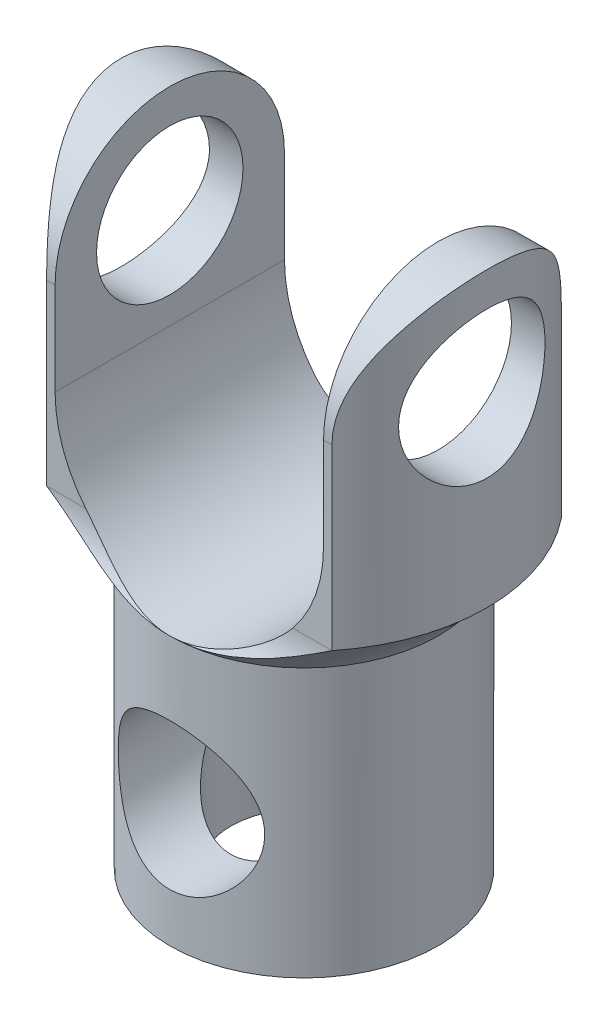
from build123d import *

# Parameters (mm, degrees)
SKETCH1_R               = 2.75
SKETCH1_R_2             = 1.5
BOSS_EXTRUDE1_DEPTH     = 4.5
SKETCH2_R               = 2.75
BOSS_EXTRUDE2_DEPTH     = 1
SKETCH4_R               = 3.75
BOSS_EXTRUDE3_DEPTH     = 6
CUT_EXTRUDE2_DEPTH      = 14.578475761
CUT_EXTRUDE2_DEPTH_BACK = 14.578475761
CUT_EXTRUDE3_DEPTH      = 14.336978811
CUT_EXTRUDE3_DEPTH_BACK = 14.336978811
CUT_EXTRUDE4_DEPTH      = 14.336978811
CUT_EXTRUDE4_DEPTH_BACK = 14.336978811
SKETCH7_R               = 1.5
SKETCH9_R               = 1.5
CUT_EXTRUDE5_DEPTH      = 14.336978811


with BuildPart() as part:
    # Sketch1 → Boss-Extrude1 (new body)
    with BuildSketch(Plane(origin=(0, 0, 0), x_dir=(1, 0, 0), z_dir=(0, 1, 0))):
        with Locations(Location((0, 0, 0), (0, 0, 270))):
            Circle(SKETCH1_R)
        with Locations(Location((0, 0, 0), (0, 0, 270))):
            Circle(SKETCH1_R_2, mode=Mode.SUBTRACT)
    extrude(amount=BOSS_EXTRUDE1_DEPTH)

    # Sketch2 → Boss-Extrude2 (add)
    with BuildSketch(Plane(origin=(0, 4.5, 0), x_dir=(1, 0, 0), z_dir=(0, 1, 0))):
        with Locations(Location((0, 0, 0), (0, 0, 270))):
            Circle(SKETCH2_R)
    extrude(amount=BOSS_EXTRUDE2_DEPTH)

    # Loft1: read off the stored shape, not the designer's step
    # Loft1: loft between two sections, ruled curve by curve
    loft1_from = [
        Edge.make_bspline([(-2.7249459, 5.5, -0.370364471), (-3.465674842, 5.5, 5.079527329), (1.984216958, 5.5, 5.820256271), (2.7249459, 5.5, 0.370364471), (3.465674842, 5.5, -5.079527329), (-1.984216958, 5.5, -5.820256271), (-2.7249459, 5.5, -0.370364471)], [0, 0, 0, 0, 0.5, 0.5, 0.5, 1, 1, 1, 1], 3, [1, 0.333333333, 0.333333333, 1, 0.333333333, 0.333333333, 1]),
    ]
    loft1_to = [
        Edge.make_bspline([(-3.66375351, 6.5, 0.799631301), (-2.064490908, 6.5, 8.127138321), (5.263016112, 6.5, 6.527875719), (3.66375351, 6.5, -0.799631301), (2.064490908, 6.5, -8.127138321), (-5.263016112, 6.5, -6.527875719), (-3.66375351, 6.5, 0.799631301)], [0, 0, 0, 0, 0.5, 0.5, 0.5, 1, 1, 1, 1], 3, [1, 0.333333333, 0.333333333, 1, 0.333333333, 0.333333333, 1]),
    ]
    loft1 = Solid(Shell([*[Face.make_surface_from_curves(loft1_from[k], loft1_to[k]) for k in range(1)], Face(Wire(loft1_from)), Face(Wire(loft1_to))]))
    add(loft1)

    # Sketch4 → Boss-Extrude3 (add)
    with BuildSketch(Plane(origin=(0, 6.5, 0), x_dir=(1, 0, 0), z_dir=(0, 1, 0))):
        with Locations(Location((0, 0, 0), (0, 0, 192.312))):
            Circle(SKETCH4_R)
    extrude(amount=BOSS_EXTRUDE3_DEPTH)

    # Sketch5 → Cut-Extrude2 (cut, two sides: drawn at the far end of the back side and taken through both)
    with BuildSketch(Plane(origin=(0, 0, 0), x_dir=(0, 0, -1), z_dir=(1, 0, 0)).offset(-CUT_EXTRUDE2_DEPTH_BACK)):
        with BuildLine():
            Line((2.35, 10.15), (2.35, 6.5))
            ThreePointArc((2.35, 6.5), (2.453708798, 5.961483519), (2.75, 5.5))
            Line((2.75, 5.5), (3.75, 6.5))
            Line((3.75, 6.5), (3.75, 12.5))
            Line((3.75, 12.5), (0, 12.5))
            ThreePointArc((0, 12.5), (1.661700936, 11.811700936), (2.35, 10.15))
        make_face()
        with BuildLine():
            ThreePointArc((-2.35, 10.15), (-1.661700936, 11.811700936), (0, 12.5))
            Line((0, 12.5), (-3.75, 12.5))
            Line((-3.75, 12.5), (-3.75, 6.5))
            Line((-3.75, 6.5), (-2.75, 5.5))
            ThreePointArc((-2.75, 5.5), (-2.453708798, 5.961483519), (-2.35, 6.5))
            Line((-2.35, 6.5), (-2.35, 10.15))
        make_face()
    extrude(amount=CUT_EXTRUDE2_DEPTH + CUT_EXTRUDE2_DEPTH_BACK, mode=Mode.SUBTRACT)

    # Sketch6 → Cut-Extrude3 (cut, two sides: drawn at the far end of the back side and taken through both)
    with BuildSketch(Plane.XY.offset(-CUT_EXTRUDE3_DEPTH_BACK)):
        with BuildLine():
            Line((2.75, 8.25), (2.75, 12.5))
            Line((2.75, 12.5), (-2.75, 12.5))
            Line((-2.75, 12.5), (-2.75, 8.25))
            ThreePointArc((-2.75, 8.25), (0, 5.5), (2.75, 8.25))
        make_face()
    extrude(amount=CUT_EXTRUDE3_DEPTH + CUT_EXTRUDE3_DEPTH_BACK, mode=Mode.SUBTRACT)

    # Sketch7 → Cut-Extrude4 (cut, two sides: drawn at the far end of the back side and taken through both)
    with BuildSketch(Plane(origin=(0, 0, 0), x_dir=(0, 0, -1), z_dir=(1, 0, 0)).offset(-CUT_EXTRUDE4_DEPTH_BACK)):
        with Locations((0, 10.3)):
            Circle(SKETCH7_R)
    extrude(amount=CUT_EXTRUDE4_DEPTH + CUT_EXTRUDE4_DEPTH_BACK, mode=Mode.SUBTRACT)

    # Sketch9 → Cut-Extrude5 (cut, through all)
    with BuildSketch(Plane.XY):
        with Locations(Location((0, 2.5, 0), (0, 0, 180))):
            Circle(SKETCH9_R)
    extrude(amount=CUT_EXTRUDE5_DEPTH, mode=Mode.SUBTRACT)


solid = part.part
